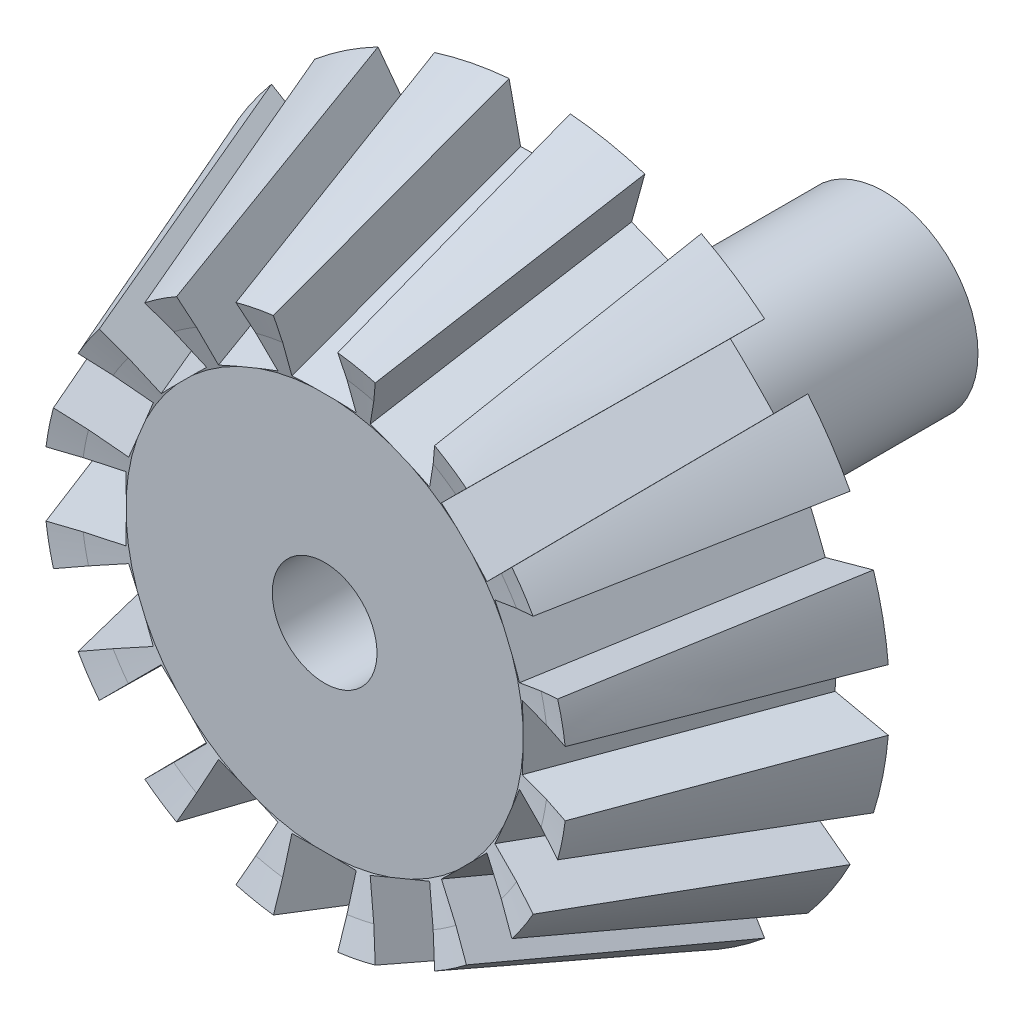
from build123d import *

# Parameters (mm, degrees)
CUT_EXTRUDE2_DEPTH      = 2.54
CIRPATTERN2_COUNT       = 16
CUT_EXTRUDE3_DEPTH      = 2.54
SKETCH3_R               = 3.6068
SKETCH3_R_2             = 2.0193
BOSS_EXTRUDE1_DEPTH     = 12.7
CUT_EXTRUDE4_DEPTH      = 23.869495015
CUT_EXTRUDE4_DEPTH_BACK = 23.869495015
SKETCH4_R               = 2.0193


with BuildPart() as part:
    # Sketch1 → Revolve1 (revolve)
    with BuildSketch(Plane(origin=(0, 0, 0), x_dir=(0, 0, -1), z_dir=(1, 0, 0))):
        Polygon((35.74584477, 13.5001), (26.716343661, 10.089936701), (27.072377446, 9.021527747), (27.451258295, 7.664529033), (27.451258295, 0), (36.347529265, 0), (36.347529265, 10.148412518), align=None)
    revolve1 = revolve(axis=Axis((0, 0, 0), (0, 0, -1)))

    # Sketch2 → Cut-Extrude2 (cut)
    with BuildSketch(Plane(origin=(0, 0, 0), x_dir=(0.9999999999999953, 9.130068833235357e-08, 3.448144617935982e-08), z_dir=(-9.759500919914732e-08, 0.9355057095803914, 0.35331157261329427))):
        Polygon((1.244598979, 27.709196061), (1.178183406, 38.374690553), (-1.414e-06, 38.374690553), (-1.178186235, 38.374690466), (-1.244601021, 27.709195969), (-1.021e-06, 27.709196061), align=None)
    cut_extrude2 = extrude(amount=-CUT_EXTRUDE2_DEPTH, mode=Mode.SUBTRACT)

    # CirPattern2: Revolve1, Cut-Extrude2 ×16 about axis
    cirpattern2_axis = Axis((0, 0, -27.072377446), (0, 0, 1))
    add([revolve1.rotate(cirpattern2_axis, i * 360 / CIRPATTERN2_COUNT) for i in range(1, CIRPATTERN2_COUNT)])
    add([cut_extrude2.rotate(cirpattern2_axis, i * 360 / CIRPATTERN2_COUNT) for i in range(1, CIRPATTERN2_COUNT)], mode=Mode.SUBTRACT)

    # Sketch2<4> → Cut-Extrude3 (cut)
    with BuildSketch(Plane(origin=(0, 0, 0), x_dir=(0.9999999999999953, 9.130068833235357e-08, 3.448144617935982e-08), z_dir=(-9.759500919914732e-08, 0.9355057095803914, 0.35331157261329427))):
        Polygon((1.244598979, 27.709196061), (1.178183406, 38.374690553), (-1.414e-06, 38.374690553), (-1.178186235, 38.374690466), (-1.244601021, 27.709195969), (-1.021e-06, 27.709196061), align=None)
    extrude(amount=-CUT_EXTRUDE3_DEPTH, mode=Mode.SUBTRACT)

    # Sketch3 → Boss-Extrude1 (add)
    with BuildSketch(Plane(origin=(0, 0, -36.347529265), x_dir=(-1, 0, 0), z_dir=(0, 0, -1))):
        Circle(SKETCH3_R)
        Circle(SKETCH3_R_2, mode=Mode.SUBTRACT)
    extrude(amount=BOSS_EXTRUDE1_DEPTH)

    # Sketch4 → Cut-Extrude4 (cut, two sides: drawn at the far end of the back side and taken through both)
    with BuildSketch(Plane(origin=(0, 0, -36.347529265), x_dir=(-1, 0, 0), z_dir=(0, 0, -1)).offset(-CUT_EXTRUDE4_DEPTH_BACK)):
        Circle(SKETCH4_R)
    extrude(amount=CUT_EXTRUDE4_DEPTH + CUT_EXTRUDE4_DEPTH_BACK, mode=Mode.SUBTRACT)


solid = part.part
